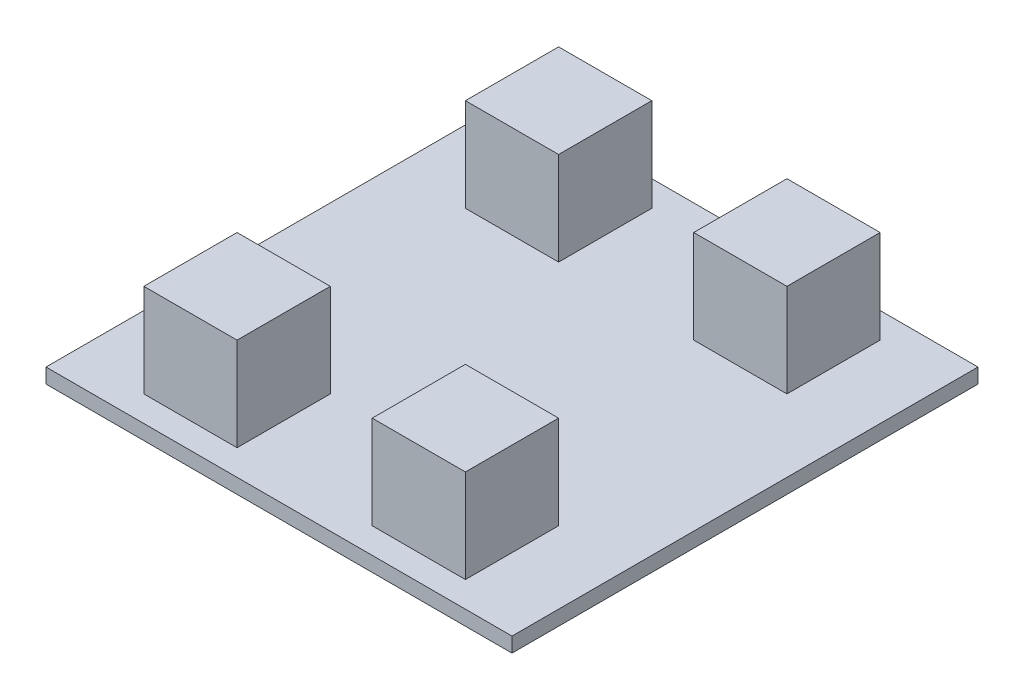
from build123d import *

# Parameters (mm, degrees)
SKETCH1_W           = 100
SKETCH1_H           = 100
BOSS_EXTRUDE1_DEPTH = 3.175
SKETCH2_W           = 20
SKETCH2_H           = 20
BOSS_EXTRUDE2_DEPTH = 20


with BuildPart() as part:
    # Sketch1 → Boss-Extrude1 (new body)
    with BuildSketch(Plane(origin=(0, 0, 0), x_dir=(1, 0, 0), z_dir=(0, 1, 0))):
        Rectangle(SKETCH1_W, SKETCH1_H)
    extrude(amount=BOSS_EXTRUDE1_DEPTH)

    # Sketch2 → Boss-Extrude2 (add)
    with BuildSketch(Plane(origin=(0, 3.175, 0), x_dir=(1, 0, 0), z_dir=(0, 1, 0))):
        with Locations((-24.5, -34.5)):
            Rectangle(SKETCH2_W, SKETCH2_H)
        with Locations((24.5, -34.5)):
            Rectangle(SKETCH2_W, SKETCH2_H)
        with Locations((24.5, 34.5)):
            Rectangle(SKETCH2_W, SKETCH2_H)
        with Locations((-24.5, 34.5)):
            Rectangle(SKETCH2_W, SKETCH2_H)
    extrude(amount=BOSS_EXTRUDE2_DEPTH)


solid = part.part
